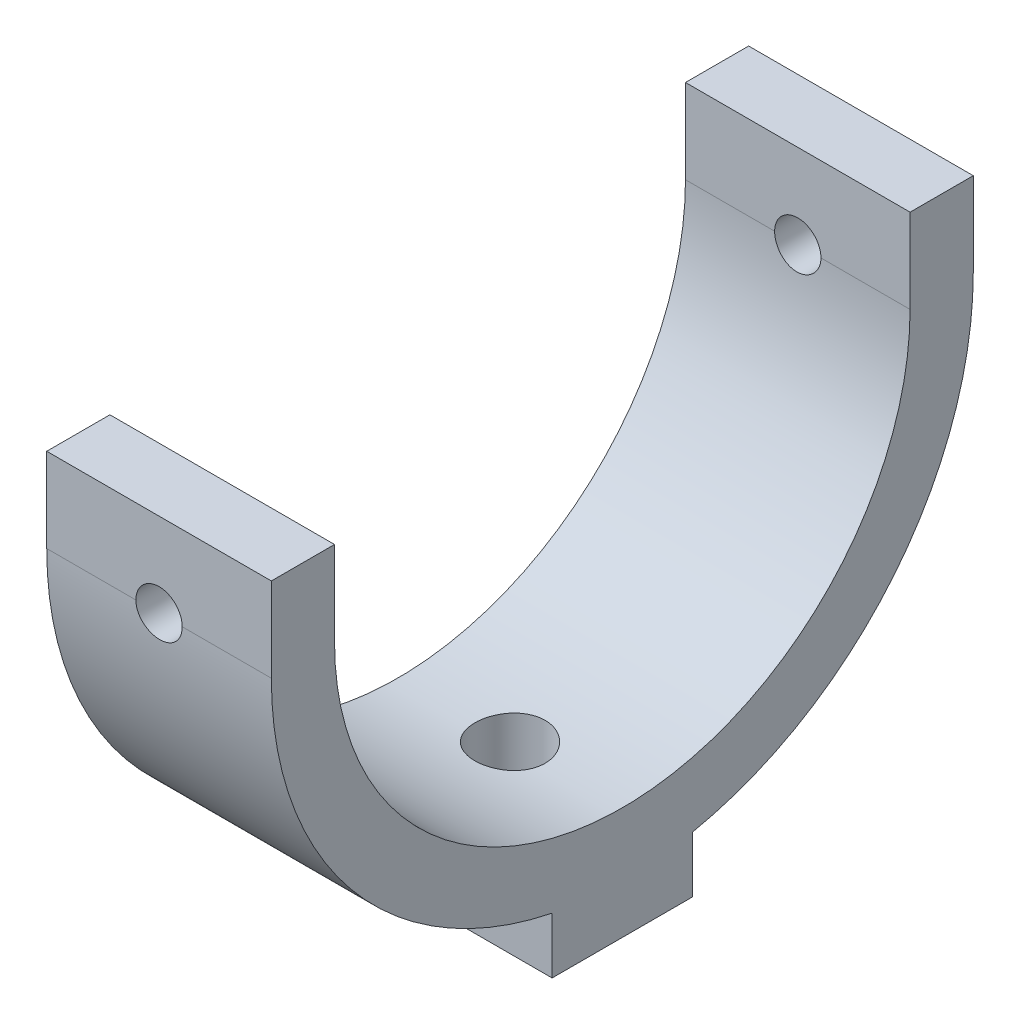
from build123d import *

# Parameters (mm, degrees)
BOSS_EXTRUDE1_DEPTH   = 16
SKETCH5_R             = 1.65
CUT_EXTRUDE1_DEPTH    = 60.732396398
M6X1_0_TAPPED_HOLE1_D = 5


with BuildPart() as part:
    # Sketch1 → Boss-Extrude1 (new body)
    with BuildSketch(Plane(origin=(0, 0, 0), x_dir=(0, 0, -1), z_dir=(1, 0, 0))):
        with BuildLine():
            Line((-5, -24.494897428), (-5, -28.494897428))
            Line((-5, -28.494897428), (5, -28.494897428))
            Line((5, -28.494897428), (5, -24.494897428))
            ThreePointArc((5, -24.494897428), (19.364916731, -15.811388301), (25, 0))
            Line((25, 0), (25, 6))
            Line((25, 6), (20.5, 6))
            Line((20.5, 6), (20.5, 0))
            ThreePointArc((20.5, 0), (0, -20.5), (-20.5, 0))
            Line((-20.5, 0), (-20.5, 6))
            Line((-20.5, 6), (-25, 6))
            Line((-25, 6), (-25, 0))
            ThreePointArc((-25, 0), (-19.364916731, -15.811388301), (-5, -24.494897428))
        make_face()
    extrude(amount=BOSS_EXTRUDE1_DEPTH)

    # Sketch5 → Cut-Extrude1 (cut, through all)
    with BuildSketch(Plane(origin=(0, 0, -25), x_dir=(-1, 0, 0), z_dir=(0, 0, -1))):
        with Locations((-8, 0)):
            Circle(SKETCH5_R)
    extrude(amount=-CUT_EXTRUDE1_DEPTH, mode=Mode.SUBTRACT)

    # M6x1.0 Tapped Hole1 (through all)
    with Locations(Plane(origin=(0, -28.494897428, 0), x_dir=(-1, 0, 0), z_dir=(0, -1, 0))):
        with Locations((-8, 0)):
            Hole(M6X1_0_TAPPED_HOLE1_D / 2)


solid = part.part
